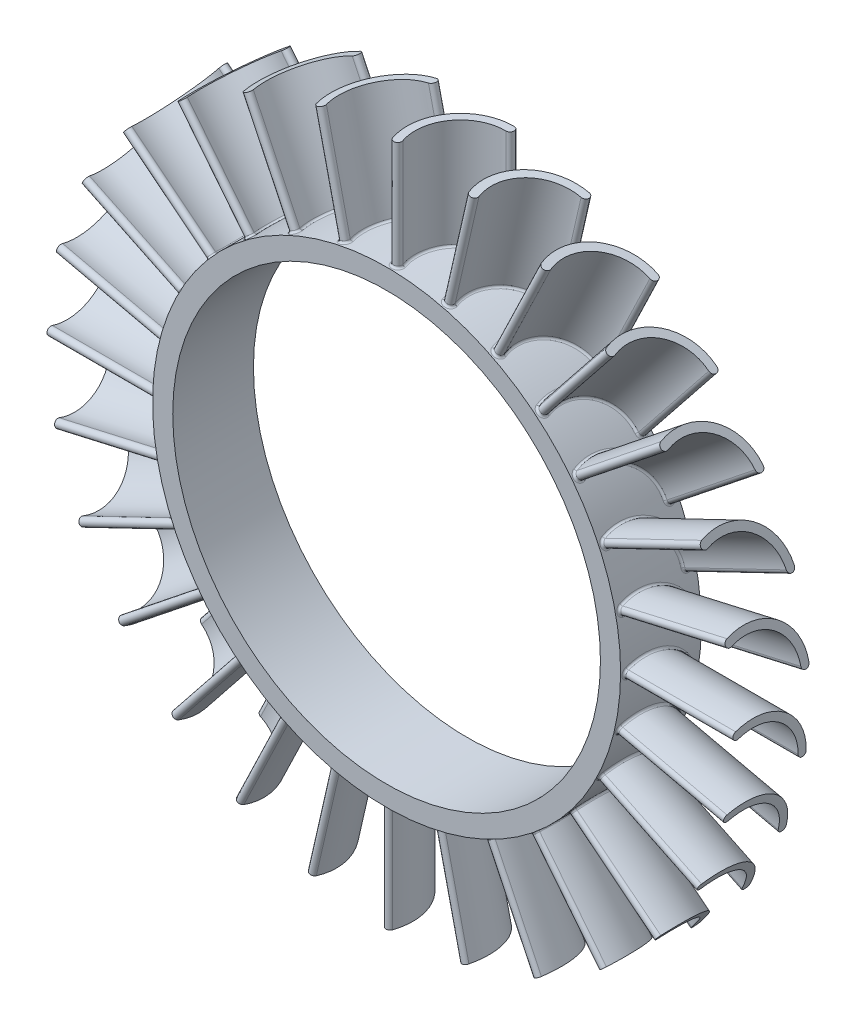
from build123d import *

# Parameters (mm, degrees)
SKETCH1_R                = 58
SKETCH1_R_2              = 53
BOSS_EXTRUDE1_DEPTH      = 10
BOSS_EXTRUDE2_START      = 55
BOSS_EXTRUDE2_DEPTH      = 30
FILLET1_R                = 0.5
CIRPATTERN1_COUNT        = 28
FILLET1_OF_CIRPATTERN1_R = 0.5


with BuildPart() as part:
    # Sketch1 → Boss-Extrude1 (new, symmetric)
    with BuildSketch(Plane.XY):
        Circle(SKETCH1_R)
        Circle(SKETCH1_R_2, mode=Mode.SUBTRACT)
    extrude(amount=BOSS_EXTRUDE1_DEPTH, both=True)

    # Sketch2 → Boss-Extrude2 (add)
    with BuildSketch(Plane(origin=(0, 0, 0), x_dir=(1, 0, 0), z_dir=(0, 1, 0)).offset(BOSS_EXTRUDE2_START)):
        with BuildLine():
            ThreePointArc((0, -8.5), (1.774775408, 3.523894596), (12.625403897, 9))
            ThreePointArc((12.625403897, 9), (13.614295904, 7.989014046), (12.603309949, 7.000122039))
            ThreePointArc((12.603309949, 7.000122039), (3.396726882, 2.353735027), (1.890858605, -7.848345387))
            ThreePointArc((1.890858605, -7.848345387), (1.271256609, -9.119601996), (0, -8.5))
        make_face()
    boss_extrude2 = extrude(amount=BOSS_EXTRUDE2_DEPTH)

    # Fillet1
    fillet1_edges = [part.edges().sort_by_distance(p)[0] for p in [
        (1.8031965, 57.971962882, -3.56313691),
        (3.423931145, 57.898848822, -2.391278691),
        (1.271292803, 57.986065694, 9.119589526),
        (1.8031965, 57.971962882, -3.56313691),
    ]]
    fillet(fillet1_edges, radius=FILLET1_R)

    # CirPattern1: Boss-Extrude2 ×28 about axis
    cirpattern1_axis = Axis((0, 0, 10), (0, 0, -1))
    for i in range(1, CIRPATTERN1_COUNT):
        add(boss_extrude2.rotate(cirpattern1_axis, i * 360 / CIRPATTERN1_COUNT))

    # Fillet1 of CirPattern1
    fillet1_of_cirpattern1_edges = [part.edges().sort_by_distance(p)[0] for p in [
        (14.657961923, 56.117235769, -3.56313691),
        (16.221791957, 55.685307443, -2.391278691),
        (14.142532333, 56.249344701, 9.119589526),
        (14.657961923, 56.117235769, -3.56313691),
        (26.777715929, 51.448556128, -3.56313691),
        (28.206224385, 50.679472228, -2.391278691),
        (26.304606238, 51.692046688, 9.119589526),
        (26.777715929, 51.448556128, -3.56313691),
        (37.554723444, 44.200031053, -3.56313691),
        (38.776278943, 43.132356656, -2.391278691),
        (37.147657347, 44.542693606, 9.119589526),
        (37.554723444, 44.200031053, -3.56313691),
        (46.44858031, 34.735131858, -3.56313691),
        (47.401928959, 33.422404617, -2.391278691),
        (46.127969802, 35.159783873, 9.119589526),
        (46.44858031, 34.735131858, -3.56313691),
        (53.013311408, 23.52846811, -3.56313691),
        (53.650648323, 22.03651365, -2.391278691),
        (52.795233237, 24.013815763, 9.119589526),
        (53.013311408, 23.52846811, -3.56313691),
        (56.919733707, 11.141988725, -3.56313691),
        (57.209100156, 9.545619872, -2.391278691),
        (56.815123225, 11.663694656, 9.119589526),
        (56.919733707, 11.141988725, -3.56313691),
        (57.971962882, -1.8031965, -3.56313691),
        (57.898848822, -3.423931145, -2.391278691),
        (57.986065694, -1.271292803, 9.119589526),
        (57.971962882, -1.8031965, -3.56313691),
        (56.117235769, -14.657961923, -3.56313691),
        (55.685307443, -16.221791957, -2.391278691),
        (56.249344701, -14.142532333, 9.119589526),
        (56.117235769, -14.657961923, -3.56313691),
        (51.448556128, -26.777715929, -3.56313691),
        (50.679472228, -28.206224385, -2.391278691),
        (51.692046688, -26.304606238, 9.119589526),
        (51.448556128, -26.777715929, -3.56313691),
        (44.200031053, -37.554723444, -3.56313691),
        (43.132356656, -38.776278943, -2.391278691),
        (44.542693606, -37.147657347, 9.119589526),
        (44.200031053, -37.554723444, -3.56313691),
        (34.735131858, -46.44858031, -3.56313691),
        (33.422404617, -47.401928959, -2.391278691),
        (35.159783873, -46.127969802, 9.119589526),
        (34.735131858, -46.44858031, -3.56313691),
        (23.52846811, -53.013311408, -3.56313691),
        (22.03651365, -53.650648323, -2.391278691),
        (24.013815763, -52.795233237, 9.119589526),
        (23.52846811, -53.013311408, -3.56313691),
        (11.141988725, -56.919733707, -3.56313691),
        (9.545619872, -57.209100156, -2.391278691),
        (11.663694656, -56.815123225, 9.119589526),
        (11.141988725, -56.919733707, -3.56313691),
        (-1.8031965, -57.971962882, -3.56313691),
        (-3.423931145, -57.898848822, -2.391278691),
        (-1.271292803, -57.986065694, 9.119589526),
        (-1.8031965, -57.971962882, -3.56313691),
        (-14.657961923, -56.117235769, -3.56313691),
        (-16.221791957, -55.685307443, -2.391278691),
        (-14.142532333, -56.249344701, 9.119589526),
        (-14.657961923, -56.117235769, -3.56313691),
        (-26.777715929, -51.448556128, -3.56313691),
        (-28.206224385, -50.679472228, -2.391278691),
        (-26.304606238, -51.692046688, 9.119589526),
        (-26.777715929, -51.448556128, -3.56313691),
        (-37.554723444, -44.200031053, -3.56313691),
        (-38.776278943, -43.132356656, -2.391278691),
        (-37.147657347, -44.542693606, 9.119589526),
        (-37.554723444, -44.200031053, -3.56313691),
        (-46.44858031, -34.735131858, -3.56313691),
        (-47.401928959, -33.422404617, -2.391278691),
        (-46.127969802, -35.159783873, 9.119589526),
        (-46.44858031, -34.735131858, -3.56313691),
        (-53.013311408, -23.52846811, -3.56313691),
        (-53.650648323, -22.03651365, -2.391278691),
        (-52.795233237, -24.013815763, 9.119589526),
        (-53.013311408, -23.52846811, -3.56313691),
        (-56.919733707, -11.141988725, -3.56313691),
        (-57.209100156, -9.545619872, -2.391278691),
        (-56.815123225, -11.663694656, 9.119589526),
        (-56.919733707, -11.141988725, -3.56313691),
        (-57.971962882, 1.8031965, -3.56313691),
        (-57.898848822, 3.423931145, -2.391278691),
        (-57.986065694, 1.271292803, 9.119589526),
        (-57.971962882, 1.8031965, -3.56313691),
        (-56.117235769, 14.657961923, -3.56313691),
        (-55.685307443, 16.221791957, -2.391278691),
        (-56.249344701, 14.142532333, 9.119589526),
        (-56.117235769, 14.657961923, -3.56313691),
        (-51.448556128, 26.777715929, -3.56313691),
        (-50.679472228, 28.206224385, -2.391278691),
        (-51.692046688, 26.304606238, 9.119589526),
        (-51.448556128, 26.777715929, -3.56313691),
        (-44.200031053, 37.554723444, -3.56313691),
        (-43.132356656, 38.776278943, -2.391278691),
        (-44.542693606, 37.147657347, 9.119589526),
        (-44.200031053, 37.554723444, -3.56313691),
        (-34.735131858, 46.44858031, -3.56313691),
        (-33.422404617, 47.401928959, -2.391278691),
        (-35.159783873, 46.127969802, 9.119589526),
        (-34.735131858, 46.44858031, -3.56313691),
        (-23.52846811, 53.013311408, -3.56313691),
        (-22.03651365, 53.650648323, -2.391278691),
        (-24.013815763, 52.795233237, 9.119589526),
        (-23.52846811, 53.013311408, -3.56313691),
        (-11.141988725, 56.919733707, -3.56313691),
        (-9.545619872, 57.209100156, -2.391278691),
        (-11.663694656, 56.815123225, 9.119589526),
        (-11.141988725, 56.919733707, -3.56313691),
    ]]
    fillet(fillet1_of_cirpattern1_edges, radius=FILLET1_OF_CIRPATTERN1_R)


solid = part.part
